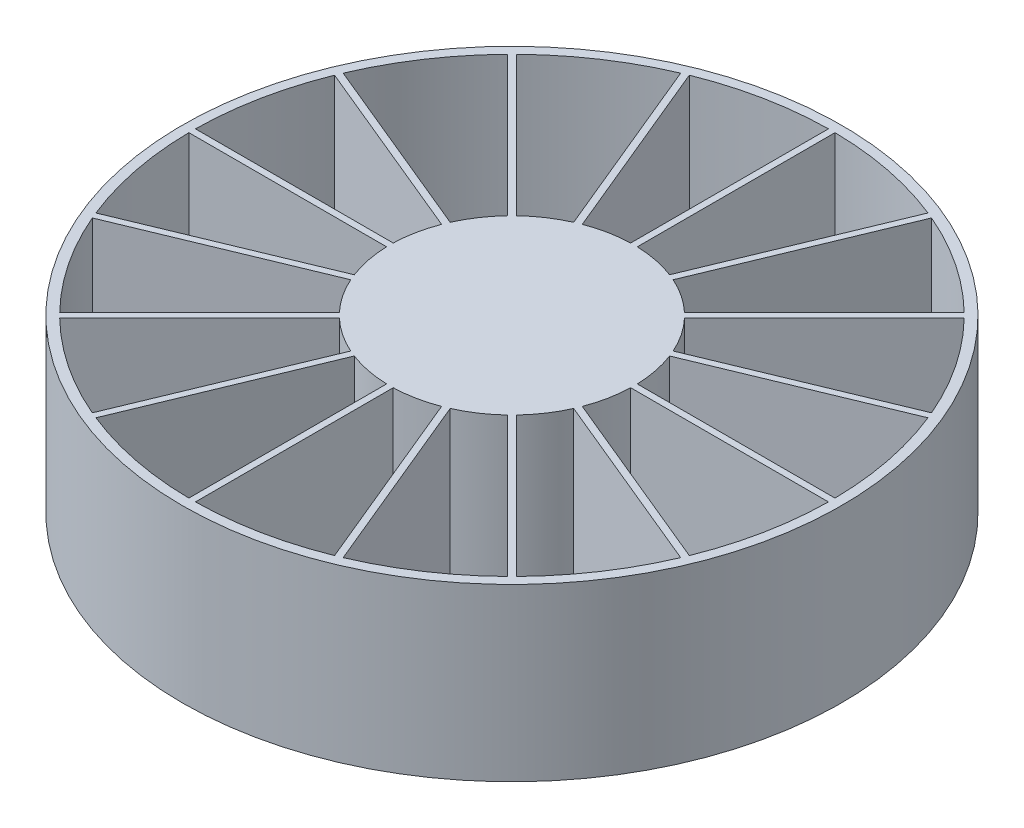
from build123d import *

# Parameters (mm, degrees)
BOSS_EXTRUDE1_OUTLINE_R = 67.5
BOSS_EXTRUDE1_DEPTH     = 35
SKETCH2_R               = 2.5
CUT_EXTRUDE2_DEPTH      = 18
SKETCH4_R               = 25
BOSS_EXTRUDE3_DEPTH     = 35
CUT_EXTRUDE4_DEPTH      = 18
CUT_EXTRUDE7_DEPTH      = 2
CUT_EXTRUDE8_DEPTH      = 30
SKETCH9_R               = 3.5
CUT_EXTRUDE9_DEPTH      = 1


# Read off the part's stored shape, not the designer's step: Boss-Extrude1
with BuildPart() as part:
    # Boss-Extrude1 outline → Boss-Extrude1 (new body)
    with BuildSketch(Plane(origin=(0, 0, 0), x_dir=(1, 0, 0), z_dir=(0, 1, 0))):
        Circle(BOSS_EXTRUDE1_OUTLINE_R)
        with BuildLine():
            ThreePointArc((-13.30331837, -14.257339175), (-10.833619544, -16.21365744), (-8.081104316, -17.746711048))
            Line((-8.081104316, -17.746711048), (-25.687679516, -60.252743681))
            ThreePointArc((-25.687679516, -60.252743681), (-36.389850263, -54.461259606), (-45.836027298, -46.790048103))
            Line((-45.836027298, -46.790048103), (-13.30331837, -14.257339175))
        make_face(mode=Mode.SUBTRACT)
        with BuildLine():
            ThreePointArc((-6.834616064, -18.263023388), (-3.804261279, -19.125312968), (-0.674594581, -19.488327844))
            Line((-0.674594581, -19.488327844), (-0.674594581, -65.496526031))
            ThreePointArc((-0.674594581, -65.496526031), (-12.778416092, -64.241435866), (-24.441191264, -60.76905602))
            Line((-24.441191264, -60.76905602), (-6.834616064, -18.263023388))
        make_face(mode=Mode.SUBTRACT)
        with BuildLine():
            ThreePointArc((-17.746711048, -8.081104316), (-16.21365744, -10.833619544), (-14.257339175, -13.30331837))
            Line((-14.257339175, -13.30331837), (-46.790048103, -45.836027298))
            ThreePointArc((-46.790048103, -45.836027298), (-54.461259606, -36.389850263), (-60.252743681, -25.687679516))
            Line((-60.252743681, -25.687679516), (-17.746711048, -8.081104316))
        make_face(mode=Mode.SUBTRACT)
        with BuildLine():
            ThreePointArc((-19.488327844, -0.674594581), (-19.125312968, -3.804261279), (-18.263023388, -6.834616064))
            Line((-18.263023388, -6.834616064), (-60.76905602, -24.441191264))
            ThreePointArc((-60.76905602, -24.441191264), (-64.241435866, -12.778416092), (-65.496526031, -0.674594581))
            Line((-65.496526031, -0.674594581), (-19.488327844, -0.674594581))
        make_face(mode=Mode.SUBTRACT)
        with BuildLine():
            ThreePointArc((0.674594581, -19.488327844), (3.804261279, -19.125312968), (6.834616064, -18.263023388))
            Line((6.834616064, -18.263023388), (24.441191264, -60.76905602))
            ThreePointArc((24.441191264, -60.76905602), (12.778416092, -64.241435866), (0.674594581, -65.496526031))
            Line((0.674594581, -65.496526031), (0.674594581, -19.488327844))
        make_face(mode=Mode.SUBTRACT)
        with BuildLine():
            ThreePointArc((8.081104316, -17.746711048), (10.833619544, -16.21365744), (13.30331837, -14.257339175))
            Line((13.30331837, -14.257339175), (45.836027298, -46.790048103))
            ThreePointArc((45.836027298, -46.790048103), (36.389850263, -54.461259606), (25.687679516, -60.252743681))
            Line((25.687679516, -60.252743681), (8.081104316, -17.746711048))
        make_face(mode=Mode.SUBTRACT)
        with BuildLine():
            ThreePointArc((14.257339175, -13.30331837), (16.21365744, -10.833619544), (17.746711048, -8.081104316))
            Line((17.746711048, -8.081104316), (60.252743681, -25.687679516))
            ThreePointArc((60.252743681, -25.687679516), (54.461259606, -36.389850263), (46.790048103, -45.836027298))
            Line((46.790048103, -45.836027298), (14.257339175, -13.30331837))
        make_face(mode=Mode.SUBTRACT)
        with BuildLine():
            ThreePointArc((18.263023388, -6.834616064), (19.125312968, -3.804261279), (19.488327844, -0.674594581))
            Line((19.488327844, -0.674594581), (65.496526031, -0.674594581))
            ThreePointArc((65.496526031, -0.674594581), (64.241435866, -12.778416092), (60.76905602, -24.441191264))
            Line((60.76905602, -24.441191264), (18.263023388, -6.834616064))
        make_face(mode=Mode.SUBTRACT)
        with BuildLine():
            ThreePointArc((-18.263023388, 6.834616064), (-19.125312968, 3.804261279), (-19.488327844, 0.674594581))
            Line((-19.488327844, 0.674594581), (-65.496526031, 0.674594581))
            ThreePointArc((-65.496526031, 0.674594581), (-64.241435866, 12.778416092), (-60.76905602, 24.441191264))
            Line((-60.76905602, 24.441191264), (-18.263023388, 6.834616064))
        make_face(mode=Mode.SUBTRACT)
        with BuildLine():
            ThreePointArc((-14.257339175, 13.30331837), (-16.21365744, 10.833619544), (-17.746711048, 8.081104316))
            Line((-17.746711048, 8.081104316), (-60.252743681, 25.687679516))
            ThreePointArc((-60.252743681, 25.687679516), (-54.461259606, 36.389850263), (-46.790048103, 45.836027298))
            Line((-46.790048103, 45.836027298), (-14.257339175, 13.30331837))
        make_face(mode=Mode.SUBTRACT)
        with BuildLine():
            ThreePointArc((-8.081104316, 17.746711048), (-10.833619544, 16.21365744), (-13.30331837, 14.257339175))
            Line((-13.30331837, 14.257339175), (-45.836027298, 46.790048103))
            ThreePointArc((-45.836027298, 46.790048103), (-36.389850263, 54.461259606), (-25.687679516, 60.252743681))
            Line((-25.687679516, 60.252743681), (-8.081104316, 17.746711048))
        make_face(mode=Mode.SUBTRACT)
        with BuildLine():
            Line((-6.834616064, 18.263023388), (-24.441191264, 60.76905602))
            ThreePointArc((-24.441191264, 60.76905602), (-12.778416092, 64.241435866), (-0.674594581, 65.496526031))
            Line((-0.674594581, 65.496526031), (-0.674594581, 19.488327844))
            ThreePointArc((-0.674594581, 19.488327844), (-3.804261279, 19.125312968), (-6.834616064, 18.263023388))
        make_face(mode=Mode.SUBTRACT)
        with BuildLine():
            ThreePointArc((19.488327844, 0.674594581), (19.125312968, 3.804261279), (18.263023388, 6.834616064))
            Line((18.263023388, 6.834616064), (60.76905602, 24.441191264))
            ThreePointArc((60.76905602, 24.441191264), (64.241435866, 12.778416092), (65.496526031, 0.674594581))
            Line((65.496526031, 0.674594581), (19.488327844, 0.674594581))
        make_face(mode=Mode.SUBTRACT)
        with BuildLine():
            ThreePointArc((17.746711048, 8.081104316), (16.21365744, 10.833619544), (14.257339175, 13.30331837))
            Line((14.257339175, 13.30331837), (46.790048103, 45.836027298))
            ThreePointArc((46.790048103, 45.836027298), (54.461259606, 36.389850263), (60.252743681, 25.687679516))
            Line((60.252743681, 25.687679516), (17.746711048, 8.081104316))
        make_face(mode=Mode.SUBTRACT)
        with BuildLine():
            ThreePointArc((6.834616064, 18.263023388), (3.804261279, 19.125312968), (0.674594581, 19.488327844))
            Line((0.674594581, 19.488327844), (0.674594581, 65.496526031))
            ThreePointArc((0.674594581, 65.496526031), (12.778416092, 64.241435866), (24.441191264, 60.76905602))
            Line((24.441191264, 60.76905602), (6.834616064, 18.263023388))
        make_face(mode=Mode.SUBTRACT)
        with BuildLine():
            ThreePointArc((13.30331837, 14.257339175), (10.833619544, 16.21365744), (8.081104316, 17.746711048))
            Line((8.081104316, 17.746711048), (25.687679516, 60.252743681))
            ThreePointArc((25.687679516, 60.252743681), (36.389850263, 54.461259606), (45.836027298, 46.790048103))
            Line((45.836027298, 46.790048103), (13.30331837, 14.257339175))
        make_face(mode=Mode.SUBTRACT)
    extrude(amount=BOSS_EXTRUDE1_DEPTH)

    # Sketch2 → Cut-Extrude2 (cut)
    with BuildSketch(Plane.XZ):
        with Locations(Location((0, 0, 0), (0, 0, 270))):
            Circle(SKETCH2_R)
    extrude(amount=-CUT_EXTRUDE2_DEPTH, mode=Mode.SUBTRACT)

    # Sketch4 → Boss-Extrude3 (add)
    with BuildSketch(Plane(origin=(0, 0, 0), x_dir=(1, 0, 0), z_dir=(0, 1, 0))):
        Circle(SKETCH4_R)
    extrude(amount=BOSS_EXTRUDE3_DEPTH)

    # Sketch5 → Cut-Extrude4 (cut)
    with BuildSketch(Plane.XZ):
        with BuildLine():
            Line((-1.5, 2), (1.5, 2))
            ThreePointArc((1.5, 2), (0, -2.5), (-1.5, 2))
        make_face()
    extrude(amount=-CUT_EXTRUDE4_DEPTH, mode=Mode.SUBTRACT)

    # Sketch6 → Cut-Extrude7 (cut)
    with BuildSketch(Plane.XZ):
        with BuildLine():
            Line((-7.714466094, 14.785533906), (0, 7.071067812))
            Line((0, 7.071067812), (7.714466094, 14.785533906))
            Line((7.714466094, 14.785533906), (11.976558152, 19.047625963))
            ThreePointArc((11.976558152, 19.047625963), (15.909902577, 15.909902577), (19.047625963, 11.976558152))
            Line((19.047625963, 11.976558152), (14.785533906, 7.714466094))
            Line((14.785533906, 7.714466094), (7.071067812, 0))
            Line((7.071067812, 0), (14.785533906, -7.714466094))
            Line((14.785533906, -7.714466094), (19.047625963, -11.976558152))
            ThreePointArc((19.047625963, -11.976558152), (15.909902577, -15.909902577), (11.976558152, -19.047625963))
            Line((11.976558152, -19.047625963), (7.714466094, -14.785533906))
            Line((7.714466094, -14.785533906), (0, -7.071067812))
            Line((0, -7.071067812), (-7.714466094, -14.785533906))
            Line((-7.714466094, -14.785533906), (-11.976558152, -19.047625963))
            ThreePointArc((-11.976558152, -19.047625963), (-15.909902577, -15.909902577), (-19.047625963, -11.976558152))
            Line((-19.047625963, -11.976558152), (-14.785533906, -7.714466094))
            Line((-14.785533906, -7.714466094), (-7.071067812, 0))
            Line((-7.071067812, 0), (-14.785533906, 7.714466094))
            Line((-14.785533906, 7.714466094), (-19.047625963, 11.976558152))
            ThreePointArc((-19.047625963, 11.976558152), (-15.909902577, 15.909902577), (-11.976558152, 19.047625963))
            Line((-11.976558152, 19.047625963), (-7.714466094, 14.785533906))
        make_face()
    extrude(amount=-CUT_EXTRUDE7_DEPTH, mode=Mode.SUBTRACT)

    # Sketch7 → Cut-Extrude8 (cut)
    with BuildSketch(Plane.XZ):
        with BuildLine():
            Line((9.899494937, 0), (20.070097993, 10.170603057))
            ThreePointArc((20.070097993, 10.170603057), (22.5, 0), (20.070097993, -10.170603057))
            Line((20.070097993, -10.170603057), (9.899494937, 0))
        make_face()
        with BuildLine():
            Line((0, 9.899494937), (-10.170603057, 20.070097993))
            ThreePointArc((-10.170603057, 20.070097993), (0, 22.5), (10.170603057, 20.070097993))
            Line((10.170603057, 20.070097993), (0, 9.899494937))
        make_face()
        with BuildLine():
            Line((0, -9.899494937), (10.170603057, -20.070097993))
            ThreePointArc((10.170603057, -20.070097993), (0, -22.5), (-10.170603057, -20.070097993))
            Line((-10.170603057, -20.070097993), (0, -9.899494937))
        make_face()
        with BuildLine():
            Line((-9.899494937, 0), (-20.070097993, -10.170603057))
            ThreePointArc((-20.070097993, -10.170603057), (-22.5, 0), (-20.070097993, 10.170603057))
            Line((-20.070097993, 10.170603057), (-9.899494937, 0))
        make_face()
    extrude(amount=-CUT_EXTRUDE8_DEPTH, mode=Mode.SUBTRACT)

    # Sketch9 → Cut-Extrude9 (cut)
    with BuildSketch(Plane(origin=(0, 2, 0), x_dir=(-1, 0, 0), z_dir=(0, -1, 0))):
        with Locations(Location((0, 0, 0), (0, 0, 90))):
            Circle(SKETCH9_R)
    extrude(amount=-CUT_EXTRUDE9_DEPTH, mode=Mode.SUBTRACT)


solid = part.part
